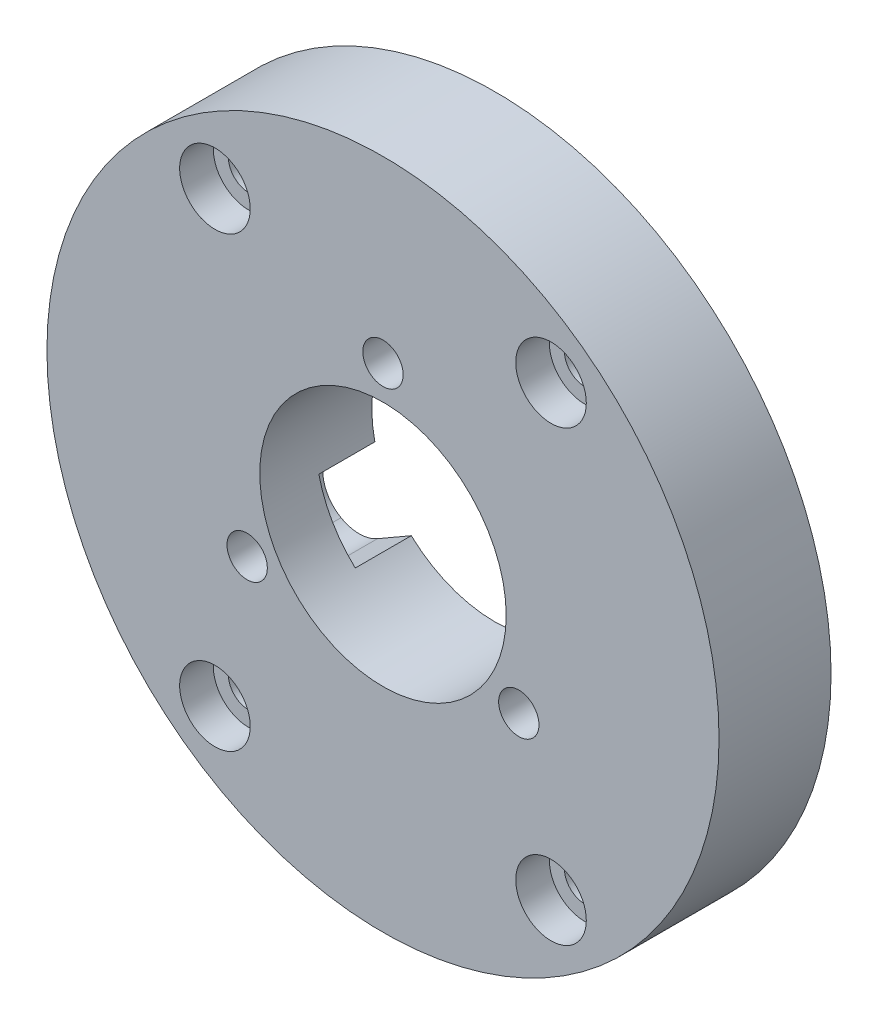
from build123d import *

# Parameters (mm, degrees)
SKETCH_1_R          = 30
EXTRUDE_1_DEPTH     = 10
CUT_EXTRUDE_1_REACH = 45.589
SKETCH_2_R          = 1.8
SKETCH_3_R          = 3.25
CUT_EXTRUDE_2_DEPTH = 5
CUT_EXTRUDE_3_REACH = 45.589
SKETCH_4_R          = 1.8
SKETCH_5_R          = 3.15
CUT_EXTRUDE_4_DEPTH = 3
CUT_EXTRUDE_5_REACH = 45.589
SKETCH_6_R          = 11
CUT_EXTRUDE_START   = -5
CUT_EXTRUDE_6_DEPTH = 5


# Read off the part's stored shape, not the designer's step: 切除-拉伸6
with BuildPart() as part:
    # 草图1 → 凸台-拉伸1 (new body)
    with BuildSketch(Plane.XY):
        Circle(SKETCH_1_R)
    extrude(amount=EXTRUDE_1_DEPTH)

    # 草图2 → 切除-拉伸1 (cut, up to next)
    with BuildSketch(Plane.XY.offset(10), mode=Mode.PRIVATE) as cut_extrude_1_sk1:
        with Locations((0, 14)):
            Circle(SKETCH_2_R)
    cut_extrude_1_tool1 = extrude(cut_extrude_1_sk1.sketch, amount=-CUT_EXTRUDE_1_REACH, mode=Mode.PRIVATE) & part.part
    # 草图2 → 切除-拉伸1 (cut, up to next)
    with BuildSketch(Plane.XY.offset(10), mode=Mode.PRIVATE) as cut_extrude_1_sk2:
        with Locations((12.124355653, -7)):
            Circle(SKETCH_2_R)
    cut_extrude_1_tool2 = extrude(cut_extrude_1_sk2.sketch, amount=-CUT_EXTRUDE_1_REACH, mode=Mode.PRIVATE) & part.part
    # 草图2 → 切除-拉伸1 (cut, up to next)
    with BuildSketch(Plane.XY.offset(10), mode=Mode.PRIVATE) as cut_extrude_1_sk3:
        with Locations((-12.124355653, -7)):
            Circle(SKETCH_2_R)
    cut_extrude_1_tool3 = extrude(cut_extrude_1_sk3.sketch, amount=-CUT_EXTRUDE_1_REACH, mode=Mode.PRIVATE) & part.part
    add(cut_extrude_1_tool1.solids().sort_by_distance((0, 14, 10))[0], mode=Mode.SUBTRACT)
    add(cut_extrude_1_tool2.solids().sort_by_distance((12.124356, -7, 10))[0], mode=Mode.SUBTRACT)
    add(cut_extrude_1_tool3.solids().sort_by_distance((-12.124356, -7, 10))[0], mode=Mode.SUBTRACT)

    # 草图3 → 切除-拉伸2 (cut)
    with BuildSketch(Plane(origin=(0, 0, 0), x_dir=(-1, 0, 0), z_dir=(0, 0, -1))):
        with Locations((0, 14)):
            Circle(SKETCH_3_R)
        with Locations((12.125855653, -6.999133975)):
            Circle(SKETCH_3_R)
        with Locations((-12.122855653, -7.000866025)):
            Circle(SKETCH_3_R)
    extrude(amount=-CUT_EXTRUDE_2_DEPTH, mode=Mode.SUBTRACT)

    # 草图4 → 切除-拉伸3 (cut, up to next)
    with BuildSketch(Plane.XY.offset(10), mode=Mode.PRIVATE) as cut_extrude_3_sk1:
        with Locations((-15, -20)):
            Circle(SKETCH_4_R)
    cut_extrude_3_tool1 = extrude(cut_extrude_3_sk1.sketch, amount=-CUT_EXTRUDE_3_REACH, mode=Mode.PRIVATE) & part.part
    # 草图4 → 切除-拉伸3 (cut, up to next)
    with BuildSketch(Plane.XY.offset(10), mode=Mode.PRIVATE) as cut_extrude_3_sk2:
        with Locations((15, -20)):
            Circle(SKETCH_4_R)
    cut_extrude_3_tool2 = extrude(cut_extrude_3_sk2.sketch, amount=-CUT_EXTRUDE_3_REACH, mode=Mode.PRIVATE) & part.part
    # 草图4 → 切除-拉伸3 (cut, up to next)
    with BuildSketch(Plane.XY.offset(10), mode=Mode.PRIVATE) as cut_extrude_3_sk3:
        with Locations((15, 20)):
            Circle(SKETCH_4_R)
    cut_extrude_3_tool3 = extrude(cut_extrude_3_sk3.sketch, amount=-CUT_EXTRUDE_3_REACH, mode=Mode.PRIVATE) & part.part
    # 草图4 → 切除-拉伸3 (cut, up to next)
    with BuildSketch(Plane.XY.offset(10), mode=Mode.PRIVATE) as cut_extrude_3_sk4:
        with Locations((-15, 20)):
            Circle(SKETCH_4_R)
    cut_extrude_3_tool4 = extrude(cut_extrude_3_sk4.sketch, amount=-CUT_EXTRUDE_3_REACH, mode=Mode.PRIVATE) & part.part
    add(cut_extrude_3_tool1.solids().sort_by_distance((-15, -20, 10))[0], mode=Mode.SUBTRACT)
    add(cut_extrude_3_tool2.solids().sort_by_distance((15, -20, 10))[0], mode=Mode.SUBTRACT)
    add(cut_extrude_3_tool3.solids().sort_by_distance((15, 20, 10))[0], mode=Mode.SUBTRACT)
    add(cut_extrude_3_tool4.solids().sort_by_distance((-15, 20, 10))[0], mode=Mode.SUBTRACT)

    # 草图5 → 切除-拉伸4 (cut)
    with BuildSketch(Plane.XY.offset(10)):
        with Locations((-15, 20)):
            Circle(SKETCH_5_R)
        with Locations((15, 20)):
            Circle(SKETCH_5_R)
        with Locations((15, -20)):
            Circle(SKETCH_5_R)
        with Locations((-15, -20)):
            Circle(SKETCH_5_R)
    extrude(amount=-CUT_EXTRUDE_4_DEPTH, mode=Mode.SUBTRACT)

    # 草图6 → 切除-拉伸5 (cut, up to next)
    with BuildSketch(Plane.XY.offset(10), mode=Mode.PRIVATE) as cut_extrude_5_sk1:
        Circle(SKETCH_6_R)
    cut_extrude_5_tool1 = extrude(cut_extrude_5_sk1.sketch, amount=-CUT_EXTRUDE_5_REACH, mode=Mode.PRIVATE) & part.part
    add(cut_extrude_5_tool1.solids().sort_by_distance((0, 0, 10))[0], mode=Mode.SUBTRACT)

    # 切除-拉伸6 outline → 切除-拉伸6 (cut)
    with BuildSketch(Plane(origin=(0, 0, 0), x_dir=(-1, 0, 0), z_dir=(0, 0, -1)).offset(CUT_EXTRUDE_START)):
        with BuildLine():
            Line((-10.725995825, -2.439879827), (-13.749355653, -4.185417438))
            ThreePointArc((-13.749355653, -4.185417438), (-15.374355624, -7.000433013), (-13.748605595, -9.815015475))
            ThreePointArc((-13.748605595, -9.815015475), (-14.784005692, -5.135181039), (-10.031538938, -4.513117164))
            ThreePointArc((-10.031538938, -4.513117164), (-10.430407021, -3.493795841), (-10.725995825, -2.439879827))
        make_face()
        with BuildLine():
            Line((-3.25, 14), (-3.25, 10.508924778))
            ThreePointArc((-3.25, 10.508924778), (-2.189145313, 10.779964879), (-1.10660044, 10.944196429))
            ThreePointArc((-1.10660044, 10.944196429), (-2.660728418, 12.133713772), (-3.25, 14))
        make_face()
        with BuildLine():
            ThreePointArc((-8.92286522, -6.432921286), (-9.15608578, -8.327808571), (-10.413102364, -9.764784202))
            Line((-10.413102364, -9.764784202), (-7.475995825, -8.069044952))
            ThreePointArc((-7.475995825, -8.069044952), (-8.240138715, -7.2869825), (-8.92286522, -6.432921286))
        make_face()
        with BuildLine():
            Line((3.25, 10.508924778), (3.25, 14))
            ThreePointArc((3.25, 14), (2.660728418, 12.133713772), (1.10660044, 10.944196429))
            ThreePointArc((1.10660044, 10.944196429), (2.189145313, 10.779964879), (3.25, 10.508924778))
        make_face()
        with BuildLine():
            ThreePointArc((8.926440063, -6.427959847), (8.242163905, -7.284691768), (7.475995825, -8.069044952))
            Line((7.475995825, -8.069044952), (10.499355653, -9.814582562))
            ThreePointArc((10.499355653, -9.814582562), (12.124788665, -10.249999971), (13.750105595, -9.81414945))
            ThreePointArc((13.750105595, -9.81414945), (10.258542955, -9.659142113), (8.926440063, -6.427959847))
        make_face()
        with BuildLine():
            ThreePointArc((10.725995825, -2.439879827), (10.430184526, -3.49446001), (10.030964095, -4.514394681))
            ThreePointArc((10.030964095, -4.514394681), (11.789659007, -3.766569697), (13.664602363, -4.136485104))
            Line((13.664602363, -4.136485104), (10.725995825, -2.439879827))
        make_face()
    extrude(amount=CUT_EXTRUDE_6_DEPTH, mode=Mode.SUBTRACT)


solid = part.part
